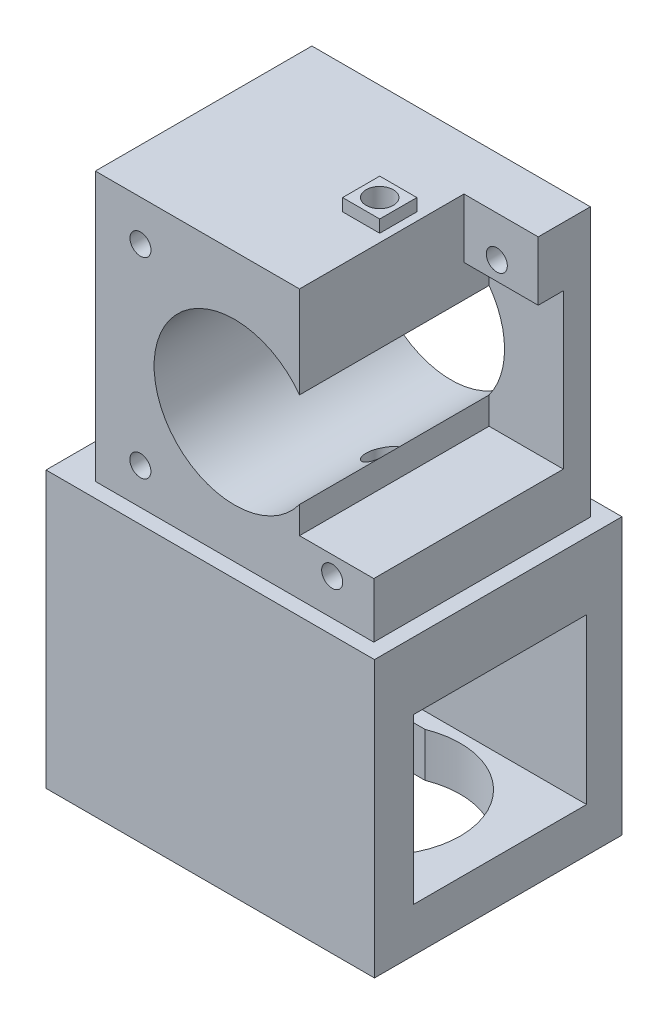
from build123d import *

# Parameters (mm, degrees)
SKETCH1_W                = 45
SKETCH1_H                = 45
BOSS_EXTRUDE1_DEPTH      = 35
SKETCH2_R                = 13
CUT_EXTRUDE3_DEPTH       = 35
SKETCH4_R                = 1.7
CUT_EXTRUDE8_DEPTH       = 35
SKETCH7_R                = 1.7
CUT_EXTRUDE9_DEPTH       = 35
SKETCH6_R                = 1.7
CUT_EXTRUDE10_DEPTH      = 35
SKETCH5_R                = 1.7
CUT_EXTRUDE11_DEPTH      = 35
CUT_EXTRUDE12_DEPTH      = 12
SKETCH14_W               = 6
SKETCH14_H               = 6
BOSS_EXTRUDE4_DEPTH      = 2
CUT_EXTRUDE17_START      = -7
SKETCH20_R               = 2.2
CUT_EXTRUDE17_DEPTH      = 70.77141069
SKETCH21_R               = 1.75
CUT_EXTRUDE18_DEPTH      = 2
BOSS_EXTRUDE5_DEPTH      = 43
BOSS_EXTRUDE5_DEPTH_BACK = 1.562633388
SKETCH22_W               = 53.082637552
SKETCH22_H               = 40
SKETCH23_W               = 28.006274302
SKETCH23_H               = 26.571190108
CUT_EXTRUDE19_DEPTH      = 93.226237808
SKETCH25_R               = 10
CUT_EXTRUDE24_DEPTH      = 4
SKETCH26_R               = 6.721032249
CUT_EXTRUDE25_DEPTH      = 5.5
SKETCH27_R               = 9
CUT_EXTRUDE28_DEPTH      = 6
SKETCH30_R               = 13
CUT_EXTRUDE30_DEPTH      = 8
SKETCH31_W               = 23.105257516
SKETCH31_H               = 23.644133728
CUT_EXTRUDE31_DEPTH      = 8


with BuildPart() as part:
    # Sketch1 → Boss-Extrude1 (new body)
    with BuildSketch(Plane.XY):
        Rectangle(SKETCH1_W, SKETCH1_H)
    extrude(amount=BOSS_EXTRUDE1_DEPTH)

    # Sketch2 → Cut-Extrude3 (cut)
    with BuildSketch(Plane.XY.offset(35)):
        Circle(SKETCH2_R)
    extrude(amount=-CUT_EXTRUDE3_DEPTH, mode=Mode.SUBTRACT)

    # Sketch4 → Cut-Extrude8 (cut)
    with BuildSketch(Plane(origin=(0, 0, 0), x_dir=(-1, 0, 0), z_dir=(0, 0, -1))):
        with Locations((-15.808862622, 15.928817575)):
            Circle(SKETCH4_R)
    extrude(amount=-CUT_EXTRUDE8_DEPTH, mode=Mode.SUBTRACT)

    # Sketch7 → Cut-Extrude9 (cut)
    with BuildSketch(Plane(origin=(0, 0, 0), x_dir=(-1, 0, 0), z_dir=(0, 0, -1))):
        with Locations((15.199970606, 15.923392722)):
            Circle(SKETCH7_R)
    extrude(amount=-CUT_EXTRUDE9_DEPTH, mode=Mode.SUBTRACT)

    # Sketch6 → Cut-Extrude10 (cut)
    with BuildSketch(Plane(origin=(0, 0, 0), x_dir=(-1, 0, 0), z_dir=(0, 0, -1))):
        with Locations((15.22029943, -15.065721832)):
            Circle(SKETCH6_R)
    extrude(amount=-CUT_EXTRUDE10_DEPTH, mode=Mode.SUBTRACT)

    # Sketch5 → Cut-Extrude11 (cut)
    with BuildSketch(Plane(origin=(0, 0, 0), x_dir=(-1, 0, 0), z_dir=(0, 0, -1))):
        with Locations((-15.781319068, -15.06525873)):
            Circle(SKETCH5_R)
    extrude(amount=-CUT_EXTRUDE11_DEPTH, mode=Mode.SUBTRACT)

    # Sketch8 → Cut-Extrude12 (cut)
    with BuildSketch(Plane(origin=(22.5, 0, 0), x_dir=(0, 0, -1), z_dir=(1, 0, 0))):
        Polygon((-4.363915061, -12.036124724), (-35, -12.036124724), (-35, 22.5), (-8.423058519, 22.5), (-8.423058519, 12.925541512), (-4.363915061, 12.925541512), align=None)
    extrude(amount=-CUT_EXTRUDE12_DEPTH, mode=Mode.SUBTRACT)

    # Sketch14 → Boss-Extrude4 (add)
    with BuildSketch(Plane(origin=(0, 22.5, 0), x_dir=(1, 0, 0), z_dir=(0, 1, 0))):
        with Locations((6.190916669, -17.729312446)):
            Rectangle(SKETCH14_W, SKETCH14_H)
    extrude(amount=BOSS_EXTRUDE4_DEPTH)

    # Sketch20 → Cut-Extrude17 (cut)
    with BuildSketch(Plane(origin=(0, 24.5, 0), x_dir=(1, 0, 0), z_dir=(0, 1, 0)).offset(CUT_EXTRUDE17_START)):
        with Locations((6.190916669, -17.729312446)):
            Circle(SKETCH20_R)
    cut_extrude17 = extrude(amount=CUT_EXTRUDE17_DEPTH, mode=Mode.SUBTRACT)

    # Sketch21 → Cut-Extrude18 (cut)
    with BuildSketch(Plane(origin=(0, 17.5, 0), x_dir=(1, 0, 0), z_dir=(0, 1, 0))):
        with Locations((6.190916669, -17.729312446)):
            Circle(SKETCH21_R)
    extrude(amount=-CUT_EXTRUDE18_DEPTH, mode=Mode.SUBTRACT)

    # Mirror6: Cut-Extrude17 across plane
    add(cut_extrude17.mirror(Plane.ZX.offset(16.5)), mode=Mode.SUBTRACT)

    # Sketch22 → Boss-Extrude5 (add, two sides: drawn at the far end of the back side and taken through both)
    with BuildSketch(Plane.XZ.offset(22.5).offset(-BOSS_EXTRUDE5_DEPTH_BACK)):
        with Locations((-1.541318776, 17.385325073)):
            Rectangle(SKETCH22_W, SKETCH22_H)
    extrude(amount=BOSS_EXTRUDE5_DEPTH + BOSS_EXTRUDE5_DEPTH_BACK)

    # Sketch23 → Cut-Extrude19 (cut, through all)
    with BuildSketch(Plane.ZY.offset(28.082637552)):
        with Locations((17.107635802, -45.073428777)):
            Rectangle(SKETCH23_W, SKETCH23_H)
    extrude(amount=-CUT_EXTRUDE19_DEPTH, mode=Mode.SUBTRACT)

    # Sketch25 → Cut-Extrude24 (cut)
    with BuildSketch(Plane(origin=(0, -20.937366612, 0), x_dir=(1, 0, 0), z_dir=(0, 1, 0))):
        with Locations((6.190916669, -17.729312446)):
            Circle(SKETCH25_R)
    extrude(amount=-CUT_EXTRUDE24_DEPTH, mode=Mode.SUBTRACT)

    # Sketch26 → Cut-Extrude25 (cut)
    with BuildSketch(Plane(origin=(0, -24.937366612, 0), x_dir=(1, 0, 0), z_dir=(0, 1, 0))):
        with Locations((6.190916669, -17.729312446)):
            Circle(SKETCH26_R)
    extrude(amount=-CUT_EXTRUDE25_DEPTH, mode=Mode.SUBTRACT)

    # Sketch27 → Cut-Extrude28 (cut)
    with BuildSketch(Plane(origin=(0, -30.437366612, 0), x_dir=(1, 0, 0), z_dir=(0, 1, 0))):
        with Locations((6.190916669, -17.729312446)):
            Circle(SKETCH27_R)
    extrude(amount=-CUT_EXTRUDE28_DEPTH, mode=Mode.SUBTRACT)

    # Sketch30 → Cut-Extrude30 (cut)
    with BuildSketch(Plane(origin=(0, -58.359023831, 0), x_dir=(1, 0, 0), z_dir=(0, 1, 0))):
        with Locations((6.207851035, -17.729312446)):
            Circle(SKETCH30_R)
    extrude(amount=-CUT_EXTRUDE30_DEPTH, mode=Mode.SUBTRACT)

    # Sketch31 → Cut-Extrude31 (cut)
    with BuildSketch(Plane.XZ.offset(65.5)):
        with Locations((-9.470070447, 17.462222744)):
            Rectangle(SKETCH31_W, SKETCH31_H)
    extrude(amount=-CUT_EXTRUDE31_DEPTH, mode=Mode.SUBTRACT)


solid = part.part
